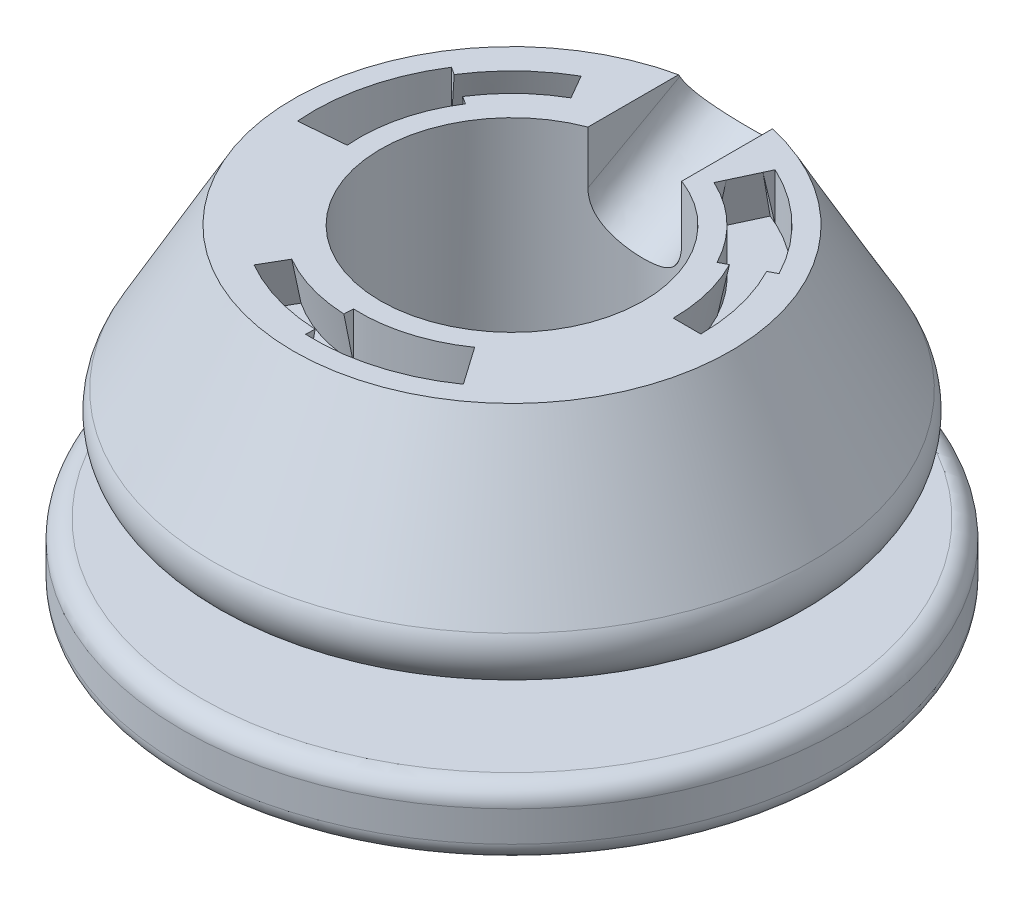
from build123d import *

# Parameters (mm, degrees)
FILLET3_R                    = 1
FILLET5_R                    = 0.5
CUT_EXTRUDE1_DEPTH           = 13
CUT_EXTRUDE1_DEPTH_BACK      = 16
SKETCH26_W                   = 13.418493541
SKETCH26_H                   = 3.548934904
CUT_EXTRUDE2_DEPTH           = 1.25
CUT_EXTRUDE2_DRAFT           = 11
CUT_EXTRUDE2_PROFILE_2_DEPTH = 1.25
CUT_EXTRUDE2_PROFILE_2_DRAFT = 11
CUT_EXTRUDE3_DEPTH           = 1.25
CIRPATTERN1_COUNT            = 3
CIRPATTERN1_COPY_1_DEPTH     = 1.25
CIRPATTERN1_COPY_1_DRAFT     = 11
CIRPATTERN1_COPY_2_DEPTH     = 1.25
CIRPATTERN1_COPY_2_DRAFT     = 11
CIRPATTERN1_COPY_3_DEPTH     = 1.25
CIRPATTERN1_COPY_3_DRAFT     = 11
CIRPATTERN1_COPY_4_DEPTH     = 1.25
CIRPATTERN1_COPY_4_DRAFT     = 11
CIRPATTERN1_COPY_5_DEPTH     = 1.25
CIRPATTERN1_COPY_5_DRAFT     = 11
CIRPATTERN1_COPY_6_DEPTH     = 1.25
CIRPATTERN1_COPY_6_DRAFT     = 11
CUT_SWEEP2_START             = 7.127158628
CUT_SWEEP2_DEPTH             = 3.327834792


# Read off the part's stored shape, not the designer's step: Cut-Sweep2
with BuildPart() as part:
    # Sketch23 → Revolve2 (revolve)
    with BuildSketch(Plane.XY, mode=Mode.PRIVATE) as revolve2_sk:
        Polygon((-4.6, 0), (-4.489164565, 2.11486609), (-4.638876985, 2.114866641), (-8.958846975, 2.114866641), (-8.958846975, 3.949340084), (-4.574918372, 3.949340084), (-4.574918372, 5.5), (-8.958846975, 5.5), (-5.875, 10.982195082), (-3.575, 11), (-3.575, 5), (-0.688248654, 5), (-3.575, 0), align=None)
    revolve(revolve2_sk.sketch.rotate(Axis((0, 11, 0), (0, -1, 0)), 270), axis=Axis((0, 11, 0), (0, -1, 0)))

    # Fillet3
    fillet3_edges = [part.edges().sort_by_distance(p)[0] for p in [
        (0, 5.5, -8.958846975),
    ]]
    fillet(fillet3_edges, radius=FILLET3_R)

    # Fillet5
    fillet5_edges = [part.edges().sort_by_distance(p)[0] for p in [
        (0, 2.114866641, -8.958846975),
        (0, 3.949340084, -8.958846975),
    ]]
    fillet(fillet5_edges, radius=FILLET5_R)

    # Sketch26 → Cut-Extrude1 (cut, two sides: drawn at the far end of the back side and taken through both)
    with BuildSketch(Plane.XY.offset(-CUT_EXTRUDE1_DEPTH_BACK)):
        with Locations((-0.203266201, 12.636633683)):
            Rectangle(SKETCH26_W, SKETCH26_H)
    extrude(amount=CUT_EXTRUDE1_DEPTH + CUT_EXTRUDE1_DEPTH_BACK, mode=Mode.SUBTRACT)


with BuildPart() as cut_extrude2_tool:
    # Sketch27 → Cut-Extrude2 (with draft: the straight prism first)
    with BuildSketch(Plane(origin=(0, 10.862166231, 0), x_dir=(1, 0, 0), z_dir=(0, 1, 0))):
        with BuildLine():
            ThreePointArc((3.888442027, 2.024194797), (4.258129874, 1.041957751), (4.383759343, 0))
            Line((4.383759343, 0), (5.133759343, 0))
            ThreePointArc((5.133759343, 0), (4.986636426, 1.22022217), (4.553700152, 2.370506257))
            Line((4.553700152, 2.370506257), (3.888442027, 2.024194797))
        make_face()
    extrude(amount=-CUT_EXTRUDE2_DEPTH)
    # Cut-Extrude2: the draft: its side faces are tilted about the plane it starts from
    cut_extrude2_sides = [cut_extrude2_tool.faces().sort_by_distance(p)[0] for p in [
        (4.22107109, 10.237166231, -2.197350527),
        (4.258129874, 10.237166231, -1.041957751),
        (4.758759343, 10.237166231, 0),
        (4.986636426, 10.237166231, -1.22022217),
    ]]
    draft(cut_extrude2_sides, Plane(origin=(0, 10.862166231, 0), x_dir=(1, 0, 0), z_dir=(0, 1, 0)), CUT_EXTRUDE2_DRAFT)


with BuildPart() as part_1:
    add(part.part)

    # Cut-Extrude2: cut by cut_extrude2_tool
    add(cut_extrude2_tool.part, mode=Mode.SUBTRACT)


with BuildPart() as cut_extrude2_profile_2_tool:
    # Sketch27 → Cut-Extrude2 profile 2 (with draft: the straight prism first)
    with BuildSketch(Plane(origin=(0, 10.862166231, 0), x_dir=(1, 0, 0), z_dir=(0, 1, 0))):
        with BuildLine():
            ThreePointArc((1.852656753, 3.973035229), (3.031426819, 3.166669768), (3.888442027, 2.024194797))
            Line((3.888442027, 2.024194797), (4.553700152, 2.370506257))
            ThreePointArc((4.553700152, 2.370506257), (3.550061611, 3.708442739), (2.16962045, 4.652766069))
            Line((2.16962045, 4.652766069), (1.852656753, 3.973035229))
        make_face()
    extrude(amount=-CUT_EXTRUDE2_PROFILE_2_DEPTH)
    # Cut-Extrude2 profile 2: the draft: its side faces are tilted about the plane it starts from
    cut_extrude2_profile_2_sides = [cut_extrude2_profile_2_tool.faces().sort_by_distance(p)[0] for p in [
        (3.550061611, 10.237166231, -3.708442739),
        (2.011138602, 10.237166231, -4.312900649),
        (3.031426819, 10.237166231, -3.166669768),
        (4.22107109, 10.237166231, -2.197350527),
    ]]
    draft(cut_extrude2_profile_2_sides, Plane(origin=(0, 10.862166231, 0), x_dir=(1, 0, 0), z_dir=(0, 1, 0)), CUT_EXTRUDE2_PROFILE_2_DRAFT)


with BuildPart() as part_2:
    add(part_1.part)

    # Cut-Extrude2 profile 2: cut by cut_extrude2_profile_2_tool
    add(cut_extrude2_profile_2_tool.part, mode=Mode.SUBTRACT)

    # Sketch27<3> → Cut-Extrude3 (cut)
    with BuildSketch(Plane(origin=(0, 10.862166231, 0), x_dir=(1, 0, 0), z_dir=(0, 1, 0))):
        with BuildLine():
            Line((3.666689319, 1.908757644), (3.888442027, 2.024194797))
            ThreePointArc((3.888442027, 2.024194797), (3.031426819, 3.166669768), (1.852656753, 3.973035229))
            Line((1.852656753, 3.973035229), (1.747002188, 3.746458282))
            ThreePointArc((1.747002188, 3.746458282), (2.858548555, 2.986078777), (3.666689319, 1.908757644))
        make_face()
        with BuildLine():
            ThreePointArc((1.852656753, 3.973035229), (3.031426819, 3.166669768), (3.888442027, 2.024194797))
            Line((3.888442027, 2.024194797), (4.553700152, 2.370506257))
            ThreePointArc((4.553700152, 2.370506257), (3.550061611, 3.708442739), (2.16962045, 4.652766069))
            Line((2.16962045, 4.652766069), (1.852656753, 3.973035229))
        make_face()
        with BuildLine():
            ThreePointArc((2.16962045, 4.652766069), (3.550061611, 3.708442739), (4.553700152, 2.370506257))
            Line((4.553700152, 2.370506257), (4.775452861, 2.485943411))
            ThreePointArc((4.775452861, 2.485943411), (3.722939875, 3.88903373), (2.275275015, 4.879343016))
            Line((2.275275015, 4.879343016), (2.16962045, 4.652766069))
        make_face()
    cut_extrude3 = extrude(amount=-CUT_EXTRUDE3_DEPTH, mode=Mode.SUBTRACT)

    # CirPattern1: Cut-Extrude3 ×3 about axis
    cirpattern1_axis = Axis((0, 0, 0), (0, 1, 0))
    for i in range(1, CIRPATTERN1_COUNT):
        add(cut_extrude3.rotate(cirpattern1_axis, i * 360 / CIRPATTERN1_COUNT), mode=Mode.SUBTRACT)


with BuildPart() as cirpattern1_copy_1_tool:
    # CirPattern1 copy 1 sketch → CirPattern1 copy 1 (with draft: the straight prism first)
    with BuildSketch(Plane(origin=(0, 10.862166231, 0), x_dir=(-0.4999999999999998, 0, -0.8660254037844387), z_dir=(0, 1, 0))):
        with BuildLine():
            ThreePointArc((3.888442027, 2.024194797), (4.258129874, 1.041957751), (4.383759343, 0))
            Line((4.383759343, 0), (5.133759343, 0))
            ThreePointArc((5.133759343, 0), (4.986636426, 1.22022217), (4.553700152, 2.370506257))
            Line((4.553700152, 2.370506257), (3.888442027, 2.024194797))
        make_face()
    extrude(amount=-CIRPATTERN1_COPY_1_DEPTH)
    # CirPattern1 copy 1: the draft: its side faces are tilted about the plane it starts from
    cirpattern1_copy_1_sides = [cirpattern1_copy_1_tool.faces().sort_by_distance(p)[0] for p in [
        (-4.013496922, 10.237166231, -2.556879532),
        (-3.031426819, 10.237166231, -3.166669768),
        (-2.379379671, 10.237166231, -4.121206482),
        (-3.55006161, 10.237166231, -3.708442739),
    ]]
    draft(cirpattern1_copy_1_sides, Plane(origin=(0, 10.862166231, 0), x_dir=(-0.4999999999999998, 0, -0.8660254037844387), z_dir=(0, 1, 0)), CIRPATTERN1_COPY_1_DRAFT)


with BuildPart() as part_3:
    add(part_2.part)

    # CirPattern1 copy 1: cut by cirpattern1_copy_1_tool
    add(cirpattern1_copy_1_tool.part, mode=Mode.SUBTRACT)


with BuildPart() as cirpattern1_copy_2_tool:
    # CirPattern1 copy 2 sketch → CirPattern1 copy 2 (with draft: the straight prism first)
    with BuildSketch(Plane(origin=(0, 10.862166231, 0), x_dir=(-0.5000000000000004, 0, 0.8660254037844384), z_dir=(0, 1, 0))):
        with BuildLine():
            ThreePointArc((3.888442027, 2.024194797), (4.258129874, 1.041957751), (4.383759343, 0))
            Line((4.383759343, 0), (5.133759343, 0))
            ThreePointArc((5.133759343, 0), (4.986636426, 1.22022217), (4.553700152, 2.370506257))
            Line((4.553700152, 2.370506257), (3.888442027, 2.024194797))
        make_face()
    extrude(amount=-CIRPATTERN1_COPY_2_DEPTH)
    # CirPattern1 copy 2: the draft: its side faces are tilted about the plane it starts from
    cirpattern1_copy_2_sides = [cirpattern1_copy_2_tool.faces().sort_by_distance(p)[0] for p in [
        (-0.207574168, 10.237166231, 4.754230059),
        (-1.226703055, 10.237166231, 4.208627519),
        (-2.379379672, 10.237166231, 4.121206482),
        (-1.436574816, 10.237166231, 4.928664909),
    ]]
    draft(cirpattern1_copy_2_sides, Plane(origin=(0, 10.862166231, 0), x_dir=(-0.5000000000000004, 0, 0.8660254037844384), z_dir=(0, 1, 0)), CIRPATTERN1_COPY_2_DRAFT)


with BuildPart() as part_4:
    add(part_3.part)

    # CirPattern1 copy 2: cut by cirpattern1_copy_2_tool
    add(cirpattern1_copy_2_tool.part, mode=Mode.SUBTRACT)


with BuildPart() as cirpattern1_copy_3_tool:
    # CirPattern1 copy 3 sketch → CirPattern1 copy 3 (with draft: the straight prism first)
    with BuildSketch(Plane(origin=(0, 10.862166231, 0), x_dir=(-0.4999999999999998, 0, -0.8660254037844387), z_dir=(0, 1, 0))):
        with BuildLine():
            ThreePointArc((1.852656753, 3.973035229), (3.031426819, 3.166669768), (3.888442027, 2.024194797))
            Line((3.888442027, 2.024194797), (4.553700152, 2.370506257))
            ThreePointArc((4.553700152, 2.370506257), (3.550061611, 3.708442739), (2.16962045, 4.652766069))
            Line((2.16962045, 4.652766069), (1.852656753, 3.973035229))
        make_face()
    extrude(amount=-CIRPATTERN1_COPY_3_DEPTH)
    # CirPattern1 copy 3: the draft: its side faces are tilted about the plane it starts from
    cirpattern1_copy_3_sides = [cirpattern1_copy_3_tool.faces().sort_by_distance(p)[0] for p in [
        (-4.986636426, 10.237166231, -1.220222171),
        (-4.740650827, 10.237166231, 0.414753205),
        (-4.258129874, 10.237166231, -1.041957751),
        (-4.013496922, 10.237166231, -2.556879532),
    ]]
    draft(cirpattern1_copy_3_sides, Plane(origin=(0, 10.862166231, 0), x_dir=(-0.4999999999999998, 0, -0.8660254037844387), z_dir=(0, 1, 0)), CIRPATTERN1_COPY_3_DRAFT)


with BuildPart() as part_5:
    add(part_4.part)

    # CirPattern1 copy 3: cut by cirpattern1_copy_3_tool
    add(cirpattern1_copy_3_tool.part, mode=Mode.SUBTRACT)


with BuildPart() as cirpattern1_copy_4_tool:
    # CirPattern1 copy 4 sketch → CirPattern1 copy 4 (with draft: the straight prism first)
    with BuildSketch(Plane(origin=(0, 10.862166231, 0), x_dir=(-0.5000000000000004, 0, 0.8660254037844384), z_dir=(0, 1, 0))):
        with BuildLine():
            ThreePointArc((1.852656753, 3.973035229), (3.031426819, 3.166669768), (3.888442027, 2.024194797))
            Line((3.888442027, 2.024194797), (4.553700152, 2.370506257))
            ThreePointArc((4.553700152, 2.370506257), (3.550061611, 3.708442739), (2.16962045, 4.652766069))
            Line((2.16962045, 4.652766069), (1.852656753, 3.973035229))
        make_face()
    extrude(amount=-CIRPATTERN1_COPY_4_DEPTH)
    # CirPattern1 copy 4: the draft: its side faces are tilted about the plane it starts from
    cirpattern1_copy_4_sides = [cirpattern1_copy_4_tool.faces().sort_by_distance(p)[0] for p in [
        (1.436574815, 10.237166231, 4.92866491),
        (2.729512225, 10.237166231, 3.898147444),
        (1.226703055, 10.237166231, 4.208627519),
        (-0.207574168, 10.237166231, 4.754230059),
    ]]
    draft(cirpattern1_copy_4_sides, Plane(origin=(0, 10.862166231, 0), x_dir=(-0.5000000000000004, 0, 0.8660254037844384), z_dir=(0, 1, 0)), CIRPATTERN1_COPY_4_DRAFT)


with BuildPart() as part_6:
    add(part_5.part)

    # CirPattern1 copy 4: cut by cirpattern1_copy_4_tool
    add(cirpattern1_copy_4_tool.part, mode=Mode.SUBTRACT)


with BuildPart() as cirpattern1_copy_5_tool:
    # CirPattern1 copy 5 sketch → CirPattern1 copy 5 (with draft: the straight prism first)
    with BuildSketch(Plane(origin=(0, 10.862166231, 0), x_dir=(-0.4999999999999998, 0, -0.8660254037844387), z_dir=(0, 1, 0))):
        with BuildLine():
            ThreePointArc((1.852656753, 3.973035229), (3.031426819, 3.166669768), (3.888442027, 2.024194797))
            Line((3.888442027, 2.024194797), (4.553700152, 2.370506257))
            ThreePointArc((4.553700152, 2.370506257), (3.550061611, 3.708442739), (2.16962045, 4.652766069))
            Line((2.16962045, 4.652766069), (1.852656753, 3.973035229))
        make_face()
    extrude(amount=-CIRPATTERN1_COPY_5_DEPTH)
    # CirPattern1 copy 5: the draft: its side faces are tilted about the plane it starts from
    cirpattern1_copy_5_sides = [cirpattern1_copy_5_tool.faces().sort_by_distance(p)[0] for p in [
        (-4.986636426, 10.237166231, -1.220222171),
        (-4.740650827, 10.237166231, 0.414753205),
        (-4.258129874, 10.237166231, -1.041957751),
        (-4.013496922, 10.237166231, -2.556879532),
    ]]
    draft(cirpattern1_copy_5_sides, Plane(origin=(0, 10.862166231, 0), x_dir=(-0.4999999999999998, 0, -0.8660254037844387), z_dir=(0, 1, 0)), CIRPATTERN1_COPY_5_DRAFT)


with BuildPart() as part_7:
    add(part_6.part)

    # CirPattern1 copy 5: cut by cirpattern1_copy_5_tool
    add(cirpattern1_copy_5_tool.part, mode=Mode.SUBTRACT)


with BuildPart() as cirpattern1_copy_6_tool:
    # CirPattern1 copy 6 sketch → CirPattern1 copy 6 (with draft: the straight prism first)
    with BuildSketch(Plane(origin=(0, 10.862166231, 0), x_dir=(-0.5000000000000004, 0, 0.8660254037844384), z_dir=(0, 1, 0))):
        with BuildLine():
            ThreePointArc((1.852656753, 3.973035229), (3.031426819, 3.166669768), (3.888442027, 2.024194797))
            Line((3.888442027, 2.024194797), (4.553700152, 2.370506257))
            ThreePointArc((4.553700152, 2.370506257), (3.550061611, 3.708442739), (2.16962045, 4.652766069))
            Line((2.16962045, 4.652766069), (1.852656753, 3.973035229))
        make_face()
    extrude(amount=-CIRPATTERN1_COPY_6_DEPTH)
    # CirPattern1 copy 6: the draft: its side faces are tilted about the plane it starts from
    cirpattern1_copy_6_sides = [cirpattern1_copy_6_tool.faces().sort_by_distance(p)[0] for p in [
        (1.436574815, 10.237166231, 4.92866491),
        (2.729512225, 10.237166231, 3.898147444),
        (1.226703055, 10.237166231, 4.208627519),
        (-0.207574168, 10.237166231, 4.754230059),
    ]]
    draft(cirpattern1_copy_6_sides, Plane(origin=(0, 10.862166231, 0), x_dir=(-0.5000000000000004, 0, 0.8660254037844384), z_dir=(0, 1, 0)), CIRPATTERN1_COPY_6_DRAFT)


with BuildPart() as part_8:
    add(part_7.part)

    # CirPattern1 copy 6: cut by cirpattern1_copy_6_tool
    add(cirpattern1_copy_6_tool.part, mode=Mode.SUBTRACT)

    # Cut-Sweep2 outline → Cut-Sweep2 (cut)
    with BuildSketch(Plane(origin=(0, 0, 0), x_dir=(1, 0, 0), z_dir=(0, 0.48234659737654595, -0.8759804564025776)).offset(CUT_SWEEP2_START)):
        with BuildLine():
            add(Edge.make_bspline(
                [(-1.275, -6.648691664), (-1.275, -4.4149415), (1.275, -4.4149415), (1.275, -6.648691664)],
                knots=[0, 0, 0, 0, 1, 1, 1, 1], degree=3, weights=[1, 0.333333333, 0.333333333, 1]))
            Line((-1.275, -6.648691664), (-1.275, -9))
            Line((-1.275, -9), (1.275, -9))
            Line((1.275, -9), (1.275, -6.648691664))
        make_face()
    extrude(amount=CUT_SWEEP2_DEPTH, mode=Mode.SUBTRACT)


solid = part_8.part
